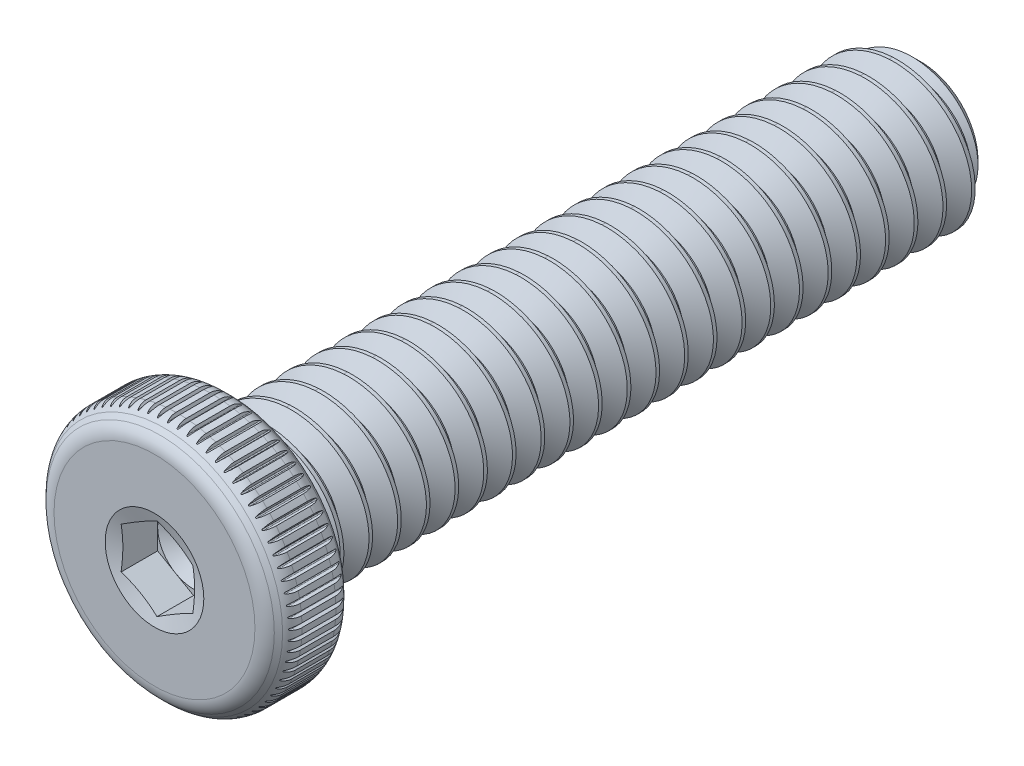
from build123d import *

# Parameters (mm, degrees)
CUT_EXTRUDE1_DEPTH = 1.0795
CUT_SWEEP1_PITCH   = 0.79375
CUT_EXTRUDE4_DEPTH = 22.756327078
CIRPATTERN1_COUNT  = 77


# Read off the part's stored shape, not the designer's step: Split1
with BuildPart() as part:
    # Sketch3 → Revolve1 (revolve)
    with BuildSketch(Plane(origin=(0, 0, 0), x_dir=(0, 0, -1), z_dir=(1, 0, 0)), mode=Mode.PRIVATE) as revolve1_sk:
        with BuildLine():
            Line((-10.6045, 2.77844714), (-10.6045, 0.9921875))
            Line((-10.6045, 0.9921875), (-9.525, 0.9921875))
            Line((-9.525, 0.9921875), (-9.525, 0))
            Line((-9.525, 0), (10.6045, 0))
            Line((10.6045, 0), (10.6045, 1.567244252))
            Line((10.6045, 1.567244252), (10.088944252, 2.0828))
            Line((10.088944252, 2.0828), (-8.4455, 2.0828))
            Line((-8.4455, 2.0828), (-8.4455, 2.967874417))
            ThreePointArc((-8.4455, 2.967874417), (-8.46589196, 3.070391721), (-8.523963347, 3.157301695))
            Line((-8.523963347, 3.157301695), (-8.638734958, 3.272073305))
            ThreePointArc((-8.638734958, 3.272073305), (-8.812554905, 3.388216081), (-9.017589513, 3.429))
            Line((-9.017589513, 3.429), (-9.95394714, 3.429))
            ThreePointArc((-9.95394714, 3.429), (-10.158981748, 3.388216081), (-10.332801695, 3.272073305))
            Line((-10.332801695, 3.272073305), (-10.447573305, 3.157301695))
            ThreePointArc((-10.447573305, 3.157301695), (-10.563716081, 2.983481748), (-10.6045, 2.77844714))
        make_face()
    revolve(revolve1_sk.sketch.rotate(Axis((0, 0, 10.6045), (0, 0, -1)), 90), axis=Axis((0, 0, 10.6045), (0, 0, -1)))

    # Sketch4 → Cut-Extrude1 (cut)
    with BuildSketch(Plane.XY.offset(10.6045)):
        Polygon((0, 1.14567944), (-0.9921875, 0.57283972), (-0.9921875, -0.57283972), (0, -1.14567944), (0.9921875, -0.57283972), (0.9921875, 0.57283972), align=None)
    extrude(amount=-CUT_EXTRUDE1_DEPTH, mode=Mode.SUBTRACT)

    # Cut-Extrude2 cone 1 section (through the dimple's axis) → Cut-Extrude2 (revolve, cut)
    with BuildSketch(Plane(origin=(0, 0, 10.6045), x_dir=(0, -1, 0), z_dir=(1, 0, 0))):
        Polygon((0, 0), (1.364257812, 0), (0, 0.430148836), align=None)
    revolve(axis=Axis((0, 0, 10.6045), (0, 0, -1)), mode=Mode.SUBTRACT)

    # Cut-Extrude3 cone 1 section (through the dimple's axis) → Cut-Extrude3 (revolve, cut)
    with BuildSketch(Plane(origin=(0, 0, 9.525), x_dir=(0, -1, 0), z_dir=(1, 0, 0))):
        Polygon((0, 0), (0.9921875, 0), (0, 0.57283972), align=None)
    revolve(axis=Axis((0, 0, 9.525), (0, 0, -1)), mode=Mode.SUBTRACT)


with BuildPart() as body_2:
    # Split1: the piece on the far side of the plane
    add(part.part)
    split(bisect_by=Plane.XY.offset(8.4455), keep=Keep.BOTTOM)

    # Cut-Sweep1: the profile of Sketch7 screwed along a right-hand helix of 24.5 turns, 8 arcs to a turn; built about Z, then put on its axis
    cut_sweep1_z = Axis((0, 0, 0), (0, 0, 1))
    cut_sweep1_corners = [(1.567244252, 0, -0.29765625), (1.567244252, 0, -0.396875), (2.125762979, 0, -0.719335937), (2.125762979, 0, 0.024804688)]
    with BuildLine(mode=Mode.PRIVATE) as cut_sweep1_profile:
        Line(cut_sweep1_corners[0], cut_sweep1_corners[1])
        Line(cut_sweep1_corners[1], cut_sweep1_corners[2])
        Line(cut_sweep1_corners[2], cut_sweep1_corners[3])
        Line(cut_sweep1_corners[3], cut_sweep1_corners[0])
    cut_sweep1_cap = Face(cut_sweep1_profile.wire())
    cut_sweep1_turn_angles = [0, 22.5, 45, 67.5, 90, 112.5, 135, 157.5, 180, 202.5, 225, 247.5, 270, 292.5, 315, 337.5, 360]
    cut_sweep1_turn_weights = [1, 0.9238795325112867, 1, 0.9238795325112867, 1, 0.9238795325112867, 1, 0.9238795325112867, 1, 0.9238795325112867, 1, 0.9238795325112867, 1, 0.9238795325112867, 1, 0.9238795325112867, 1]
    cut_sweep1_turn_rails = [Edge.make_bspline([Vector(p[0], p[1], 0).rotate(cut_sweep1_z, cut_sweep1_turn_angles[k]) / cut_sweep1_turn_weights[k] + Vector(0, 0, p[2] + CUT_SWEEP1_PITCH * cut_sweep1_turn_angles[k] / 360) for k in range(17)], [0, 0, 0, 1, 1, 2, 2, 3, 3, 4, 4, 5, 5, 6, 6, 7, 7, 8, 8, 8], 2, cut_sweep1_turn_weights) for p in cut_sweep1_corners]
    cut_sweep1_turn_sides = [Face.make_surface_from_curves(cut_sweep1_turn_rails[p[0]], cut_sweep1_turn_rails[p[1]]) for p in [(0, 1), (1, 2), (2, 3), (3, 0)]]
    cut_sweep1_last_angles = [8640, 8662.5, 8685, 8707.5, 8730, 8752.5, 8775, 8797.5, 8820]
    cut_sweep1_last_weights = [1, 0.9238795325112867, 1, 0.9238795325112867, 1, 0.9238795325112867, 1, 0.9238795325111714, 1]
    cut_sweep1_last_rails = [Edge.make_bspline([Vector(p[0], p[1], 0).rotate(cut_sweep1_z, cut_sweep1_last_angles[k]) / cut_sweep1_last_weights[k] + Vector(0, 0, p[2] + CUT_SWEEP1_PITCH * cut_sweep1_last_angles[k] / 360) for k in range(9)], [0, 0, 0, 1, 1, 2, 2, 3, 3, 4, 4, 4], 2, cut_sweep1_last_weights) for p in cut_sweep1_corners]
    cut_sweep1_last_sides = [Face.make_surface_from_curves(cut_sweep1_last_rails[p[0]], cut_sweep1_last_rails[p[1]]) for p in [(0, 1), (1, 2), (2, 3), (3, 0)]]
    cut_sweep1 = Plane(origin=(0, 0, -10.6045), x_dir=(0, 1, 0), z_dir=(0, 0, 1)) * Solid(Shell([*[p.moved(Location((0, 0, CUT_SWEEP1_PITCH * i))) for i in range(24) for p in cut_sweep1_turn_sides], *cut_sweep1_last_sides, cut_sweep1_cap, cut_sweep1_cap.rotate(cut_sweep1_z, 8820).moved(Location((0, 0, CUT_SWEEP1_PITCH * 8820 / 360)))]))
    add(cut_sweep1, mode=Mode.SUBTRACT)


with BuildPart() as part_1:
    add(part.part)

    # Split1
    split(bisect_by=Plane.XY.offset(8.4455), keep=Keep.TOP)

    add(body_2.part)  # Revolve2 merges body 2
    # Sketch11 → Revolve2 (revolve)
    with BuildSketch(Plane(origin=(0, 0, 0), x_dir=(0, 0, -1), z_dir=(1, 0, 0))):
        Polygon((-8.4455, 2.2812375), (-8.2470625, 2.0828), (-8.048625, 2.0828), (-5.965825, 0), (-8.4455, 0), (-8.95216028, 0), (-8.95216028, 2.2812375), align=None)
    revolve(axis=Axis((0, 0, 5.965825), (0, 0, 1)))

    # Sketch12 → Cut-Extrude4 (cut, through all)
    with BuildSketch(Plane.XY.offset(10.6045)):
        with BuildLine():
            Line((0.17145, 3.662084983), (-0.17145, 3.662084983))
            Line((-0.17145, 3.662084983), (-0.019202992, 3.354837104))
            ThreePointArc((-0.019202992, 3.354837104), (0, 3.342921292), (0.019202992, 3.354837104))
            Line((0.019202992, 3.354837104), (0.17145, 3.662084983))
        make_face()
    cut_extrude4 = extrude(amount=-CUT_EXTRUDE4_DEPTH, mode=Mode.SUBTRACT)

    # CirPattern1: Cut-Extrude4 ×77 about axis
    cirpattern1_axis = Axis((0, 0, 0), (0, 0, 1))
    for i in range(1, CIRPATTERN1_COUNT):
        add(cut_extrude4.rotate(cirpattern1_axis, i * 360 / CIRPATTERN1_COUNT), mode=Mode.SUBTRACT)


solid = part_1.part
